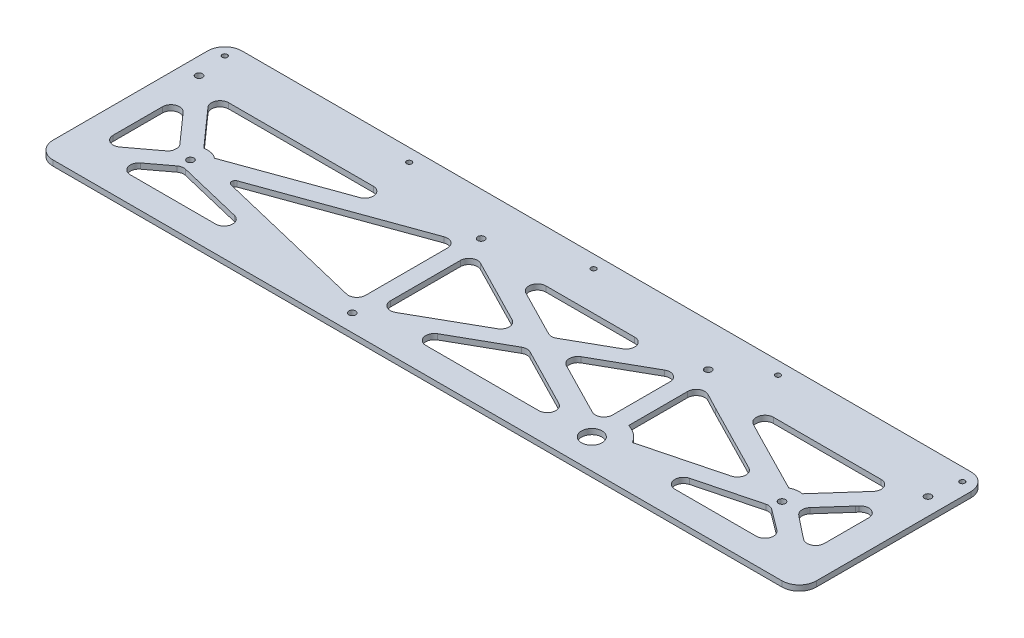
from build123d import *

# Parameters (mm, degrees)
SKETCH1_R           = 2
SKETCH1_R_2         = 6
SKETCH1_R_3         = 1.5
BOSS_EXTRUDE1_DEPTH = 3.175
FILLET1_R           = 10
CUT_EXTRUDE1_DEPTH  = 10


with BuildPart() as part:
    # Sketch1 → Boss-Extrude1 (new body)
    with BuildSketch(Plane(origin=(0, 0, 0), x_dir=(1, 0, 0), z_dir=(0, 1, 0))):
        Polygon((-26.799577535, 0), (417.700422465, 0), (417.700422465, 17.22815868), (417.700422465, 110), (-26.799577535, 110), align=None)
        with Locations((23.200422465, 40)):
            Circle(SKETCH1_R, mode=Mode.SUBTRACT)
        with Locations((367.700422465, 40)):
            Circle(SKETCH1_R, mode=Mode.SUBTRACT)
        with Locations((147.450422465, 10)):
            Circle(SKETCH1_R, mode=Mode.SUBTRACT)
        with Locations((279.700422465, 17.22815868)):
            Circle(SKETCH1_R_2, mode=Mode.SUBTRACT)
        with Locations((-16.799577535, 85)):
            Circle(SKETCH1_R, mode=Mode.SUBTRACT)
        with Locations((147.450422465, 85)):
            Circle(SKETCH1_R, mode=Mode.SUBTRACT)
        with Locations((279.700422465, 85)):
            Circle(SKETCH1_R, mode=Mode.SUBTRACT)
        with Locations((407.700422465, 85)):
            Circle(SKETCH1_R, mode=Mode.SUBTRACT)
        with Locations((-19.299577535, 102.5)):
            Circle(SKETCH1_R_3, mode=Mode.SUBTRACT)
        with Locations((88.075422465, 102.5)):
            Circle(SKETCH1_R_3, mode=Mode.SUBTRACT)
        with Locations((195.450422465, 102.5)):
            Circle(SKETCH1_R_3, mode=Mode.SUBTRACT)
        with Locations((302.825422465, 102.5)):
            Circle(SKETCH1_R_3, mode=Mode.SUBTRACT)
        with Locations((410.200422465, 102.5)):
            Circle(SKETCH1_R_3, mode=Mode.SUBTRACT)
    extrude(amount=BOSS_EXTRUDE1_DEPTH)

    # Fillet1
    fillet1_edges = [part.edges().sort_by_distance(p)[0] for p in [
        (417.700422465, 1.5875, -110),
        (417.700422465, 1.5875, 0),
        (-26.799577535, 1.5875, 0),
        (-26.799577535, 1.5875, -110),
    ]]
    fillet(fillet1_edges, radius=FILLET1_R)

    # Sketch2 → Cut-Extrude1 (cut)
    with BuildSketch(Plane(origin=(0, 3.175, 0), x_dir=(1, 0, 0), z_dir=(0, 1, 0))):
        with BuildLine():
            Line((63.988295206, 24.860334116), (26.456586442, 33.922316112))
            ThreePointArc((26.456586442, 33.922316112), (24.273585164, 33.959016834), (22.283065126, 33.061981996))
            Line((22.283065126, 33.061981996), (10.200422465, 24))
            ThreePointArc((10.200422465, 24), (8.457005975, 18.41886117), (13.200422465, 15))
            Line((13.200422465, 15), (62.81477389, 15))
            ThreePointArc((62.81477389, 15), (67.779734645, 19.409098393), (63.988295206, 24.860334116))
        make_face()
        with BuildLine():
            Line((1.731814293, 71.678180806), (21.183909441, 49.794573764))
            ThreePointArc((21.183909441, 49.794573764), (25.478109933, 49.737152551), (29.35222616, 47.883863983))
            Line((29.35222616, 47.883863983), (83.514557274, 67.5))
            Line((83.514557274, 67.5), (91.361350439, 70.2886824))
            ThreePointArc((91.361350439, 70.2886824), (94.61428981, 75.849532813), (89.686988926, 80))
            Line((89.686988926, 80), (5.468860886, 80))
            ThreePointArc((5.468860886, 80), (0.907660607, 77.048280258), (1.731814293, 71.678180806))
        make_face()
        with BuildLine():
            ThreePointArc((13.203172612, 39.765489068), (13.250707237, 41.001582191), (13.450490987, 42.222349247))
            ThreePointArc((13.450490987, 42.222349247), (13.034220935, 43.599450655), (12.243072673, 44.801021905))
            Line((12.243072673, 44.801021905), (-3.062530941, 62.019825971))
            ThreePointArc((-3.062530941, 62.019825971), (-8.576480322, 63.371615284), (-11.799577535, 58.698006777))
            Line((-11.799577535, 58.698006777), (-11.799577535, 30))
            ThreePointArc((-11.799577535, 30), (-9.035645512, 25.527864045), (-3.799577535, 26))
            Line((-3.799577535, 26), (11.506026079, 37.479202711))
            ThreePointArc((11.506026079, 37.479202711), (12.520785414, 38.498983342), (13.203172612, 39.765489068))
        make_face()
        with BuildLine():
            Line((47.554716749, 39.2633668), (136.276901149, 17.841511412))
            ThreePointArc((136.276901149, 17.841511412), (140.543349349, 18.773257577), (142.450422465, 22.701845528))
            Line((142.450422465, 22.701845528), (142.450422465, 70.404600889))
            ThreePointArc((142.450422465, 70.404600889), (140.32155553, 74.498082894), (135.747784496, 75.105773503))
            Line((135.747784496, 75.105773503), (47.343070087, 43.087969492))
            ThreePointArc((47.343070087, 43.087969492), (46.027180577, 41.096993104), (47.554716749, 39.2633668))
        make_face()
        with BuildLine():
            Line((152.450422465, 67.944146827), (152.450422465, 27.234106769))
            ThreePointArc((152.450422465, 27.234106769), (154.931598866, 22.91490225), (159.912633536, 22.882381061))
            Line((159.912633536, 22.882381061), (197.668168627, 44.244503287))
            ThreePointArc((197.668168627, 44.244503287), (200.204889799, 48.699555799), (197.486244065, 53.045981061))
            Line((197.486244065, 53.045981061), (159.730708974, 72.393898891))
            ThreePointArc((159.730708974, 72.393898891), (154.842878846, 72.210376576), (152.450422465, 67.944146827))
        make_face()
        with BuildLine():
            Line((274.700422465, 34.284011853), (274.700422465, 67.765893231))
            ThreePointArc((274.700422465, 67.765893231), (272.219246064, 72.08509775), (267.238211394, 72.117618939))
            Line((267.238211394, 72.117618939), (236.186256017, 54.548389301))
            ThreePointArc((236.186256017, 54.548389301), (233.649534845, 50.093336789), (236.368180579, 45.746911528))
            Line((236.368180579, 45.746911528), (267.420135956, 29.834259789))
            ThreePointArc((267.420135956, 29.834259789), (272.307966085, 30.017782104), (274.700422465, 34.284011853))
        make_face()
        with BuildLine():
            Line((284.700422465, 68.076898184), (284.700422465, 33.714803321))
            ThreePointArc((284.700422465, 33.714803321), (290.246819989, 30.85104203), (294.408739409, 26.198937028))
            Line((294.408739409, 26.198937028), (340.058508189, 38.011769879))
            ThreePointArc((340.058508189, 38.011769879), (343.775835313, 42.304727092), (341.082359043, 47.304045862))
            Line((341.082359043, 47.304045862), (301.204849524, 67.695954138))
            Line((301.204849524, 67.695954138), (292.020165923, 72.506208546))
            ThreePointArc((292.020165923, 72.506208546), (287.111862758, 72.354673148), (284.700422465, 68.076898184))
        make_face()
        with BuildLine():
            Line((320.393543744, 70.570564095), (326.257240647, 67.5))
            Line((326.257240647, 67.5), (362.890344157, 48.767162978))
            ThreePointArc((362.890344157, 48.767162978), (366.212170141, 49.888635144), (369.716935489, 49.794573764))
            Line((369.716935489, 49.794573764), (389.169030638, 71.678180806))
            ThreePointArc((389.169030638, 71.678180806), (389.993184323, 77.048280258), (385.431984044, 80))
            Line((385.431984044, 80), (322.713047476, 80))
            ThreePointArc((322.713047476, 80), (317.857783347, 76.194324176), (320.393543744, 70.570564095))
        make_face()
        with BuildLine():
            Line((379.559027243, 37.88827322), (390.700422465, 29))
            Line((390.700422465, 29), (393.166651981, 27.150327863))
            ThreePointArc((393.166651981, 27.150327863), (398.402719958, 26.678191908), (401.166651981, 31.150327863))
            Line((401.166651981, 31.150327863), (401.166651981, 57.012678354))
            ThreePointArc((401.166651981, 57.012678354), (397.901307442, 61.70213146), (392.370263808, 60.266512529))
            Line((392.370263808, 60.266512529), (391.437469059, 59.178180806))
            Line((391.437469059, 59.178180806), (378.940138766, 45.118684227))
            ThreePointArc((378.940138766, 45.118684227), (377.695401669, 41.370448261), (379.559027243, 37.88827322))
        make_face()
        with BuildLine():
            Line((364.296086649, 33.954363295), (329.076499674, 24.840558227))
            ThreePointArc((329.076499674, 24.840558227), (325.369116008, 19.368648725), (330.329095399, 15))
            Line((330.329095399, 15), (377.700422465, 15))
            ThreePointArc((377.700422465, 15), (382.443838955, 18.41886117), (380.700422465, 24))
            Line((380.700422465, 24), (368.548682375, 33.113805068))
            ThreePointArc((368.548682375, 33.113805068), (366.518213167, 34.018905479), (364.296086649, 33.954363295))
        make_face()
        with BuildLine():
            Line((185.278283157, 15), (251.008650991, 15))
            ThreePointArc((251.008650991, 15), (255.869142752, 18.82713179), (253.2889375, 24.449752065))
            Line((253.2889375, 24.449752065), (218.797900418, 42.124769774))
            ThreePointArc((218.797900418, 42.124769774), (216.414300992, 42.67395024), (214.055427015, 42.026757098))
            Line((214.055427015, 42.026757098), (182.816096263, 24.351739388))
            ThreePointArc((182.816096263, 24.351739388), (180.443063568, 18.726951874), (185.278283157, 15))
        make_face()
        with BuildLine():
            Line((241.872561773, 80), (190.247225864, 80))
            ThreePointArc((190.247225864, 80), (185.386734103, 76.17286821), (187.966939355, 70.550247935))
            Line((187.966939355, 70.550247935), (215.056569824, 56.668099447))
            ThreePointArc((215.056569824, 56.668099447), (217.44016925, 56.118918981), (219.799043227, 56.766112124))
            Line((219.799043227, 56.766112124), (244.334748667, 70.648260612))
            ThreePointArc((244.334748667, 70.648260612), (246.707781362, 76.273048126), (241.872561773, 80))
        make_face()
    extrude(amount=-CUT_EXTRUDE1_DEPTH, mode=Mode.SUBTRACT)


solid = part.part
